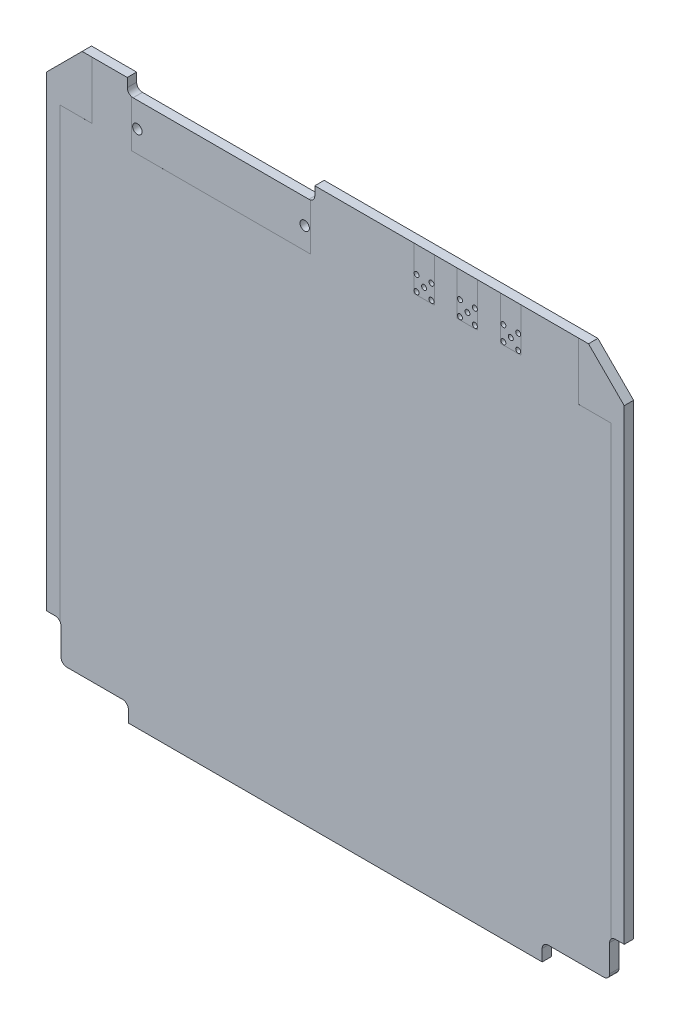
from build123d import *

# Parameters (mm, degrees)
SKETCH1_R           = 0.425
SKETCH1_R_2         = 0.8
BOSS_EXTRUDE1_DEPTH = 1.6
CUT_EXTRUDE1_DEPTH  = 0.0001
CUT_EXTRUDE2_DEPTH  = 0.0001
PARTFOOTPRINTS_W    = 30.48
PARTFOOTPRINTS_H    = 7.989227112
PARTFOOTPRINTS_W_2  = 3.5
PARTFOOTPRINTS_H_2  = 7.45
CUT_EXTRUDE3_DEPTH  = 0.0001


with BuildPart() as part:
    # Sketch1 → Boss-Extrude1 (new body)
    with BuildSketch(Plane(origin=(0, 0, -0.0125), x_dir=(-1, 0, 0), z_dir=(0, 0, -1))):
        with BuildLine():
            Line((35.3, -50), (35.3, -48))
            ThreePointArc((35.3, -48), (35.592893219, -47.292893219), (36.3, -47))
            Line((36.3, -47), (45.8, -47))
            ThreePointArc((45.8, -47), (46.507106781, -46.707106781), (46.8, -46))
            Line((46.8, -46), (46.8, -41.4))
            ThreePointArc((46.8, -41.4), (47.092893219, -40.692893219), (47.8, -40.4))
            Line((47.8, -40.4), (49.3, -40.4))
            Line((49.3, -40.4), (49.3, 39.2))
            Line((49.3, 39.2), (43.2, 45.3))
            Line((43.2, 45.3), (35.500000002, 45.3))
            Line((35.500000002, 45.3), (35.500000002, 43.8))
            ThreePointArc((35.500000002, 43.8), (35.207106783, 43.092893219), (34.500000002, 42.8))
            Line((34.500000002, 42.8), (4.499999998, 42.8))
            ThreePointArc((4.499999998, 42.8), (3.792893217, 43.092893219), (3.499999998, 43.8))
            Line((3.499999998, 43.8), (3.499999998, 45.3))
            Line((3.499999998, 45.3), (-43.2, 45.3))
            Line((-43.2, 45.3), (-49.3, 39.2))
            Line((-49.3, 39.2), (-49.3, -40.4))
            Line((-49.3, -40.4), (-47.8, -40.4))
            ThreePointArc((-47.8, -40.4), (-47.092893219, -40.692893219), (-46.8, -41.4))
            Line((-46.8, -41.4), (-46.8, -46))
            ThreePointArc((-46.8, -46), (-46.507106781, -46.707106781), (-45.8, -47))
            Line((-45.8, -47), (-36.3, -47))
            ThreePointArc((-36.3, -47), (-35.592893219, -47.292893219), (-35.3, -48))
            Line((-35.3, -48), (-35.3, -50))
            Line((-35.3, -50), (35.3, -50))
        make_face()
        with Locations((-21.27, 40.87)):
            Circle(SKETCH1_R, mode=Mode.SUBTRACT)
        with Locations((-23.81, 40.87)):
            Circle(SKETCH1_R, mode=Mode.SUBTRACT)
        with Locations((-22.54, 39.6)):
            Circle(SKETCH1_R, mode=Mode.SUBTRACT)
        with Locations((-13.87, 40.87)):
            Circle(SKETCH1_R, mode=Mode.SUBTRACT)
        with Locations((-23.81, 38.33)):
            Circle(SKETCH1_R, mode=Mode.SUBTRACT)
        with Locations((-16.41, 40.87)):
            Circle(SKETCH1_R, mode=Mode.SUBTRACT)
        with Locations((-15.14, 39.6)):
            Circle(SKETCH1_R, mode=Mode.SUBTRACT)
        with Locations((-21.27, 38.33)):
            Circle(SKETCH1_R, mode=Mode.SUBTRACT)
        with Locations((-28.67, 40.87)):
            Circle(SKETCH1_R, mode=Mode.SUBTRACT)
        with Locations((-31.21, 40.87)):
            Circle(SKETCH1_R, mode=Mode.SUBTRACT)
        with Locations((-16.41, 38.33)):
            Circle(SKETCH1_R, mode=Mode.SUBTRACT)
        with Locations((-29.94, 39.6)):
            Circle(SKETCH1_R, mode=Mode.SUBTRACT)
        with Locations((-31.21, 38.33)):
            Circle(SKETCH1_R, mode=Mode.SUBTRACT)
        with Locations((-28.67, 38.33)):
            Circle(SKETCH1_R, mode=Mode.SUBTRACT)
        with Locations((33.775, 38.54)):
            Circle(SKETCH1_R_2, mode=Mode.SUBTRACT)
        with Locations((5.225, 38.54)):
            Circle(SKETCH1_R_2, mode=Mode.SUBTRACT)
        with Locations((-13.87, 38.33)):
            Circle(SKETCH1_R, mode=Mode.SUBTRACT)
    extrude(amount=-BOSS_EXTRUDE1_DEPTH)

    # thermalContacts_lower → Cut-Extrude1 (cut)
    with BuildSketch(Plane(origin=(0, 0, -0.0125), x_dir=(-1, 0, 0), z_dir=(0, 0, -1))):
        Polygon((-47, 35.5), (-47, -41.5), (-56.192158269, -41.5), (-56.192158269, 47), (-41.5, 47), (-41.5, 41.5), (-41.5, 35.5), align=None)
        Polygon((47, 35.5), (47, -41.5), (59.827263463, -41.5), (59.827263463, 47), (41.5, 47), (41.5, 41.5), (41.5, 35.5), align=None)
    extrude(amount=-CUT_EXTRUDE1_DEPTH, mode=Mode.SUBTRACT)

    # thermalContacts_upper → Cut-Extrude2 (cut)
    with BuildSketch(Plane.XY.offset(1.5875)):
        Polygon((-47, 35.5), (-47, -41.5), (-56.192158269, -41.5), (-56.192158269, 47), (-41.5, 47), (-41.5, 41.5), (-41.5, 35.5), align=None)
        Polygon((47, 35.5), (47, -41.5), (59.827263463, -41.5), (59.827263463, 47), (41.5, 47), (41.5, 41.5), (41.5, 35.5), align=None)
    extrude(amount=-CUT_EXTRUDE2_DEPTH, mode=Mode.SUBTRACT)

    # partFootprints → Cut-Extrude3 (cut)
    with BuildSketch(Plane.XY.offset(1.5875)):
        with Locations((-19.5, 38.834613556)):
            Rectangle(PARTFOOTPRINTS_W, PARTFOOTPRINTS_H)
        with Locations((15.14, 41.575)):
            Rectangle(PARTFOOTPRINTS_W_2, PARTFOOTPRINTS_H_2)
        with Locations((22.54, 41.575)):
            Rectangle(PARTFOOTPRINTS_W_2, PARTFOOTPRINTS_H_2)
        with Locations((29.94, 41.575)):
            Rectangle(PARTFOOTPRINTS_W_2, PARTFOOTPRINTS_H_2)
    extrude(amount=-CUT_EXTRUDE3_DEPTH, mode=Mode.SUBTRACT)


solid = part.part
